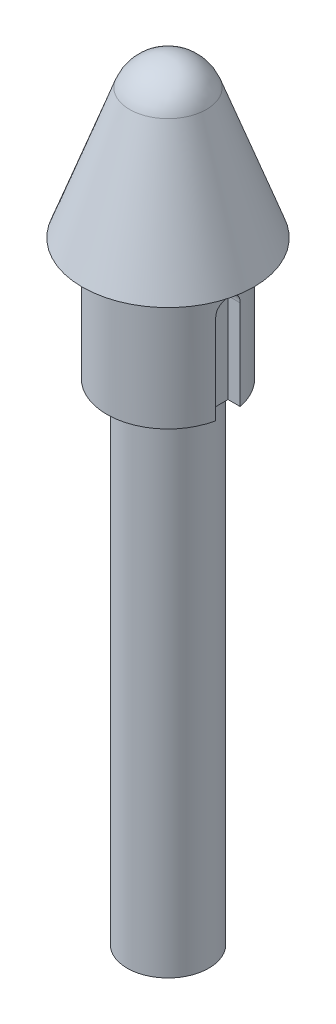
from build123d import *

# Parameters (mm, degrees)
SKETCH2_W          = 5
SKETCH2_H          = 120
CUT_EXTRUDE1_START = -25
CUT_EXTRUDE1_DEPTH = 25
FILLET1_R          = 3


with BuildPart() as part:
    # Sketch1 → Revolve1 (revolve)
    with BuildSketch(Plane.XY, mode=Mode.PRIVATE) as revolve1_sk:
        with BuildLine():
            Line((0, -150), (15, -150))
            Line((15, -150), (15, 0))
            Line((15, 0), (21, 0))
            Line((21, 0), (9.396926208, 31.87918324))
            ThreePointArc((9.396926208, 31.87918324), (5.735764364, 36.65050225), (0, 38.458981807))
            Line((0, 38.458981807), (0, -150))
        make_face()
    revolve(revolve1_sk.sketch.rotate(Axis((0, -160.189242242, 0), (0, 1, 0)), 90), axis=Axis((0, -160.189242242, 0), (0, 1, 0)))

    # Sketch2 → Cut-Revolve1 (revolve, cut)
    with BuildSketch(Plane.XY):
        with Locations((12.5, -90)):
            Rectangle(SKETCH2_W, SKETCH2_H)
    revolve(axis=Axis((0, 9.42117093, 0), (0, -1, 0)), mode=Mode.SUBTRACT)

    # Sketch3 → Cut-Extrude1 (cut)
    with BuildSketch(Plane.XZ.offset(30).offset(CUT_EXTRUDE1_START)):
        with BuildLine():
            Line((14.696938457, 3), (11.696938457, 3))
            Line((11.696938457, 3), (11.696938457, -3))
            Line((11.696938457, -3), (14.696938457, -3))
            ThreePointArc((14.696938457, -3), (15, 0), (14.696938457, 3))
        make_face()
    extrude(amount=CUT_EXTRUDE1_DEPTH, mode=Mode.SUBTRACT)

    # Fillet1
    fillet1_edges = [part.edges().sort_by_distance(p)[0] for p in [
        (13.196938457, -5, 3),
        (13.196938457, -5, -3),
    ]]
    fillet(fillet1_edges, radius=FILLET1_R - 0.0001)  # a hair under: the kernel refuses the full size


solid = part.part
